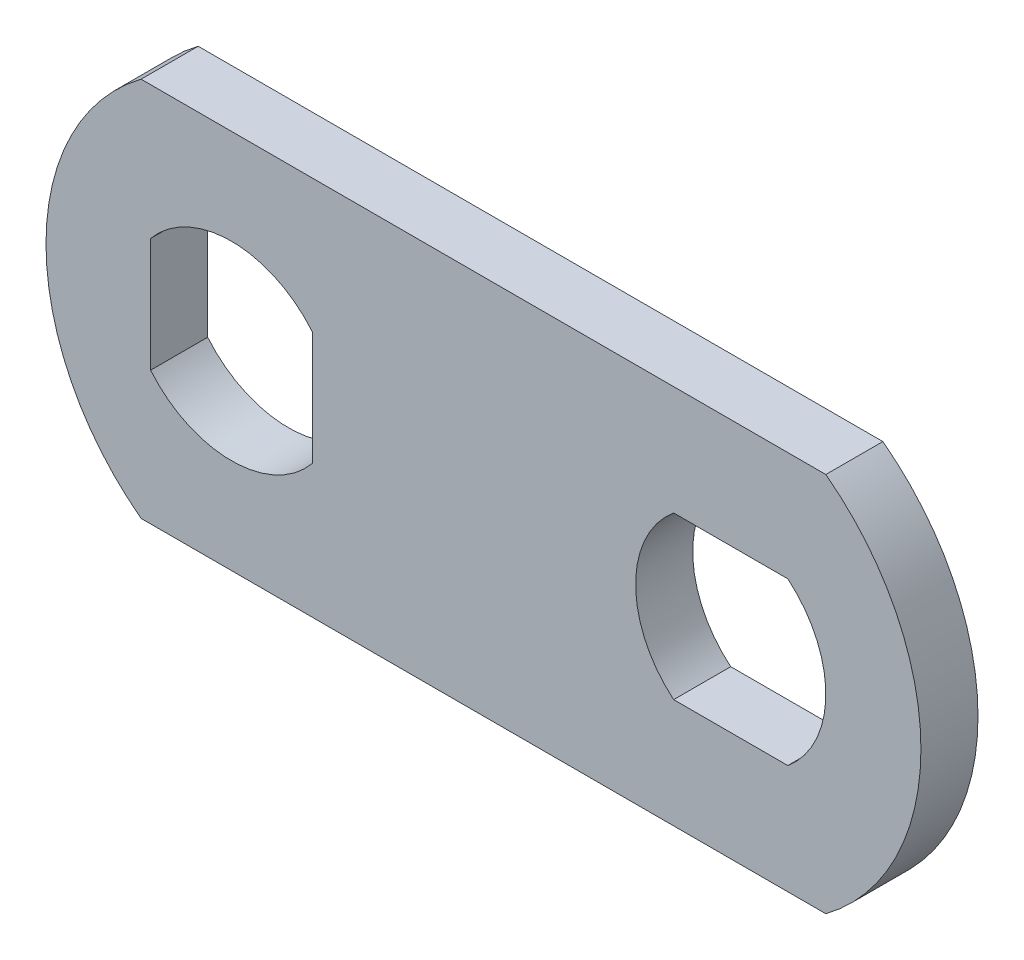
from build123d import *

# Parameters (mm, degrees)
BASE_FLANGE1_DEPTH = 3
CUT_EXTRUDE1_DEPTH = 10


# Sheet-metal steps are written as plain solids
with BuildPart() as part:
    # Sketch1 → Base-Flange1 (new body)
    with BuildSketch(Plane.XY):
        with BuildLine():
            Line((5, 10), (41, 10))
            ThreePointArc((41, 10), (46, 0), (41, -10))
            Line((41, -10), (5, -10))
            ThreePointArc((5, -10), (0, 0), (5, 10))
        make_face()
    extrude(amount=-BASE_FLANGE1_DEPTH)

    # Sketch4 → Cut-Extrude1 (cut)
    with BuildSketch(Plane.XY):
        with BuildLine():
            Line((5.5, 3), (5.5, -3))
            ThreePointArc((5.5, -3), (9.75, -5), (14, -3))
            Line((14, -3), (14, 3))
            ThreePointArc((14, 3), (9.75, 5), (5.5, 3))
        make_face()
        with BuildLine():
            Line((39, 4.25), (33, 4.25))
            ThreePointArc((33, 4.25), (31, 0), (33, -4.25))
            Line((33, -4.25), (39, -4.25))
            ThreePointArc((39, -4.25), (41, 0), (39, 4.25))
        make_face()
    extrude(amount=-CUT_EXTRUDE1_DEPTH, mode=Mode.SUBTRACT)


solid = part.part
